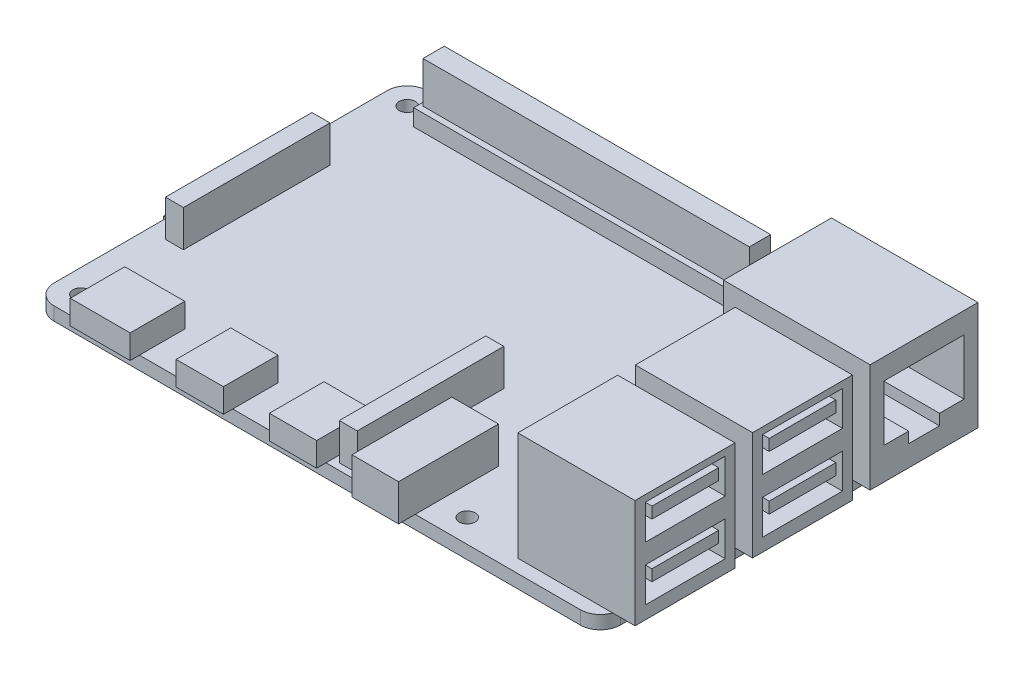
from build123d import *

# Parameters (mm, degrees)
ESQUISSE1_W             = 85
ESQUISSE1_H             = 56
BOSS_EXTRU_1_DEPTH      = 2
D_GAGEMENT_M21_D        = 2.4
ESQUISSE4_W             = 50
ESQUISSE4_H             = 5
BOSS_EXTRU_3_DEPTH      = 2.5
ESQUISSE6_W             = 49
ESQUISSE6_H             = 3.2
BOSS_EXTRU_5_DEPTH      = 6.2
ESQUISSE3_W             = 22
ESQUISSE3_H             = 16.2
ESQUISSE3_W_2           = 17.6
ESQUISSE3_H_2           = 15
BOSS_EXTRU_2_DEPTH      = 16.3
ESQUISSE7_W             = 12
ESQUISSE7_H             = 5.2
ESQUISSE7_W_2           = 10
ESQUISSE7_H_2           = 1.7
ENL_V_MAT_EXTRU_1_DEPTH = 12
ESQUISSE5_W             = 9
ESQUISSE5_H             = 8.2
ESQUISSE5_W_2           = 7.1
BOSS_EXTRU_4_DEPTH      = 3.6
ESQUISSE8_W             = 7
ESQUISSE8_H             = 15
ESQUISSE8_W_2           = 2.7
ESQUISSE8_H_2           = 22
BOSS_EXTRU_6_DEPTH      = 5.5
ESQUISSE9_W             = 15.5
ESQUISSE9_H             = 12.2
BOSS_EXTRU_7_DEPTH      = 1.5
CONG_1_R                = 3


with BuildPart() as part:
    # Esquisse1 → Boss.-Extru.1 (new body)
    with BuildSketch(Plane(origin=(0, 0, 0), x_dir=(1, 0, 0), z_dir=(0, 1, 0))):
        Rectangle(ESQUISSE1_W, ESQUISSE1_H)
    extrude(amount=BOSS_EXTRU_1_DEPTH)

    # Dégagement M21 (through all)
    with Locations(Plane(origin=(-39, 2, -24.5), x_dir=(0, 0, 1), z_dir=(0, 1, 0))):
        with Locations((0, 0), (49, 0), (0, 58), (49, 58)):
            Hole(D_GAGEMENT_M21_D / 2)

    # Esquisse4 → Boss.-Extru.3 (add)
    with BuildSketch(Plane(origin=(0, 2, 0), x_dir=(1, 0, 0), z_dir=(0, 1, 0))):
        with Locations((-10.795881497, 24.765474627)):
            Rectangle(ESQUISSE4_W, ESQUISSE4_H)
    extrude(amount=BOSS_EXTRU_3_DEPTH)

    # Esquisse6 → Boss.-Extru.5 (add)
    with BuildSketch(Plane(origin=(0, 4.5, 0), x_dir=(1, 0, 0), z_dir=(0, 1, 0))):
        with Locations((-10.795881497, 24.765474627)):
            Rectangle(ESQUISSE6_W, ESQUISSE6_H)
    extrude(amount=BOSS_EXTRU_5_DEPTH)

    # Esquisse3 → Boss.-Extru.2 (add)
    with BuildSketch(Plane(origin=(0, 2, 0), x_dir=(1, 0, 0), z_dir=(0, 1, 0))):
        with Locations((34.7, 17.4)):
            Rectangle(ESQUISSE3_W, ESQUISSE3_H)
        with Locations((36.9, -18.5)):
            Rectangle(ESQUISSE3_W_2, ESQUISSE3_H_2)
        with Locations((36.9, -0.85)):
            Rectangle(ESQUISSE3_W_2, ESQUISSE3_H_2)
    extrude(amount=BOSS_EXTRU_2_DEPTH)

    # Esquisse7 → Enlèv. mat.-Extru.1 (cut)
    # profile 1 of 5: a face of its own
    with BuildSketch(Plane(origin=(45.7, 0, 0), x_dir=(0, 0, -1), z_dir=(1, 0, 0))):
        Polygon((23.4, 15.15), (11.4, 15.15), (11.4, 6.785251797), (15.080363944, 6.785251797), (15.080363944, 5.15), (19.719636056, 5.15), (19.719636056, 6.785251797), (23.4, 6.785251797), align=None)
    # profile 2 of 5: a face of its own
    with BuildSketch(Plane(origin=(45.7, 0, 0), x_dir=(0, 0, -1), z_dir=(1, 0, 0))):
        with Locations((-18.45, 14.7)):
            Rectangle(ESQUISSE7_W, ESQUISSE7_H)
        with Locations((-18.45, 15.45)):
            Rectangle(ESQUISSE7_W_2, ESQUISSE7_H_2, mode=Mode.SUBTRACT)
    # profile 3 of 5: a face of its own
    with BuildSketch(Plane(origin=(45.7, 0, 0), x_dir=(0, 0, -1), z_dir=(1, 0, 0))):
        with Locations((-0.85, 14.7)):
            Rectangle(ESQUISSE7_W, ESQUISSE7_H)
        with Locations((-0.85, 15.45)):
            Rectangle(ESQUISSE7_W_2, ESQUISSE7_H_2, mode=Mode.SUBTRACT)
    # profile 4 of 5: a face of its own
    with BuildSketch(Plane(origin=(45.7, 0, 0), x_dir=(0, 0, -1), z_dir=(1, 0, 0))):
        with Locations((-18.45, 6.55)):
            Rectangle(ESQUISSE7_W, ESQUISSE7_H)
        with Locations((-18.45, 7.3)):
            Rectangle(ESQUISSE7_W_2, ESQUISSE7_H_2, mode=Mode.SUBTRACT)
    # profile 5 of 5: a face of its own
    with BuildSketch(Plane(origin=(45.7, 0, 0), x_dir=(0, 0, -1), z_dir=(1, 0, 0))):
        with Locations((-0.85, 6.55)):
            Rectangle(ESQUISSE7_W, ESQUISSE7_H)
        with Locations((-0.85, 7.3)):
            Rectangle(ESQUISSE7_W_2, ESQUISSE7_H_2, mode=Mode.SUBTRACT)
    extrude(amount=-ENL_V_MAT_EXTRU_1_DEPTH, mode=Mode.SUBTRACT)

    # Esquisse5 → Boss.-Extru.4 (add)
    with BuildSketch(Plane(origin=(0, 2, 0), x_dir=(1, 0, 0), z_dir=(0, 1, 0))):
        with Locations((-31.2, -25.3)):
            Rectangle(ESQUISSE5_W, ESQUISSE5_H)
        with Locations((-16.25, -25.3)):
            Rectangle(ESQUISSE5_W_2, ESQUISSE5_H)
        with Locations((-2.25, -25.3)):
            Rectangle(ESQUISSE5_W_2, ESQUISSE5_H)
    extrude(amount=BOSS_EXTRU_4_DEPTH)

    # Esquisse8 → Boss.-Extru.6 (add)
    with BuildSketch(Plane(origin=(0, 2, 0), x_dir=(1, 0, 0), z_dir=(0, 1, 0))):
        with Locations((11.2, -23)):
            Rectangle(ESQUISSE8_W, ESQUISSE8_H)
        with Locations((3.65, -16)):
            Rectangle(ESQUISSE8_W_2, ESQUISSE8_H_2)
        with Locations((-38.45, 0)):
            Rectangle(ESQUISSE8_W_2, ESQUISSE8_H_2)
    extrude(amount=BOSS_EXTRU_6_DEPTH)

    # Esquisse9 → Boss.-Extru.7 (add)
    with BuildSketch(Plane.XZ):
        with Locations((-37.25, 0)):
            Rectangle(ESQUISSE9_W, ESQUISSE9_H)
    extrude(amount=BOSS_EXTRU_7_DEPTH)

    # Congé1
    # the kernel refuses this fillet: 3 mm, written as the material it takes off along each edge
    with BuildSketch(Plane(origin=(42.5, -7.5, 28), x_dir=(0, 0, -1), z_dir=(0, 1, 0)), Plane(origin=(42.5, -7.5, -28), x_dir=(-1, 0, 0), z_dir=(0, 1, 0))) as cong_1_piece_1:
        with BuildLine():
            CenterArc((CONG_1_R, CONG_1_R), CONG_1_R, 180, 90)
            Line((0, CONG_1_R), (0, 0))
            Line((0, 0), (CONG_1_R, 0))
        make_face()
    extrude(amount=9.5, mode=Mode.SUBTRACT)
    with BuildSketch(Plane(origin=(-42.5, -7.5, 28), x_dir=(0, 0, -1), z_dir=(0, 1, 0)), Plane(origin=(-42.5, -7.5, -28), x_dir=(1, 0, 0), z_dir=(0, 1, 0))) as cong_1_piece_2:
        with BuildLine():
            CenterArc((CONG_1_R, -CONG_1_R), CONG_1_R, 90, 90)
            Line((0, -CONG_1_R), (0, 0))
            Line((0, 0), (CONG_1_R, 0))
        make_face()
    extrude(amount=17, mode=Mode.SUBTRACT)


solid = part.part
